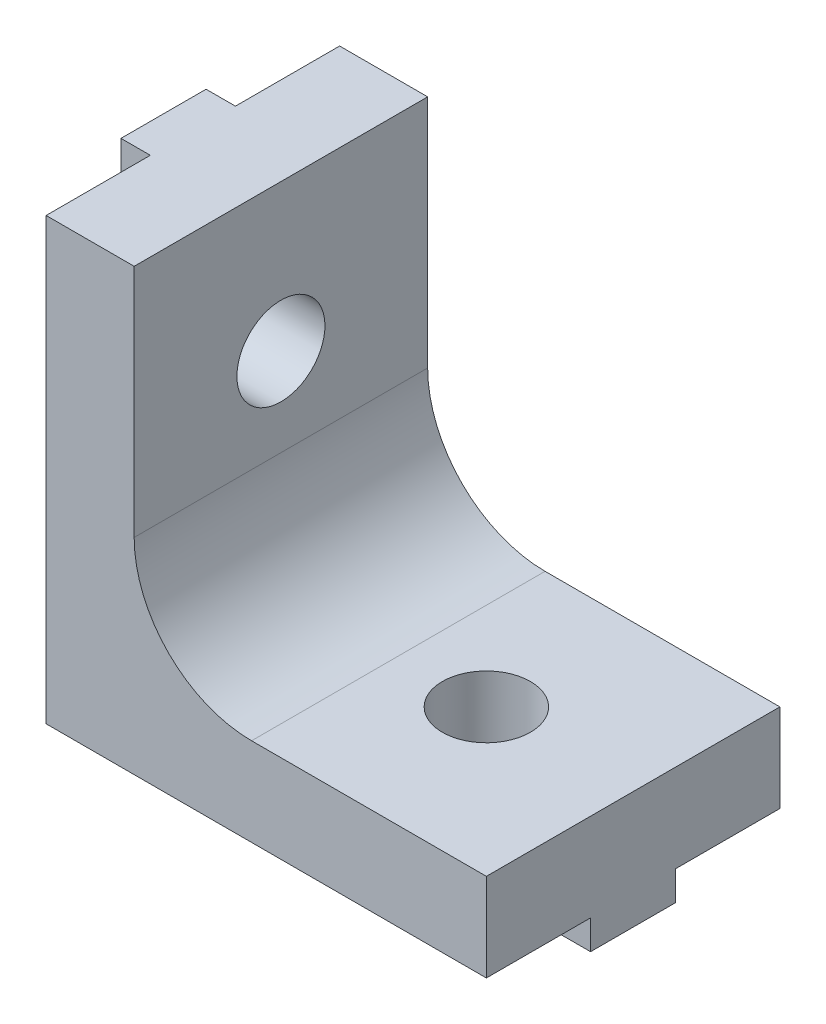
from build123d import *

# Parameters (mm, degrees)
BOSS_EXTRU_1_DEPTH           = 10
ESQUISSE4_W                  = 2.9
ESQUISSE4_H                  = 15
BOSS_EXTRU_2_DEPTH           = 1
ENL_V_MAT_EXTRU_1_DEPTH      = 24.452078799
ENL_V_MAT_EXTRU_1_DEPTH_BACK = 24.452078799
ESQUISSE2_R                  = 1.5
ESQUISSE5_W                  = 15
ESQUISSE5_H                  = 2.9
BOSS_EXTRU_3_DEPTH           = 1
ENL_V_MAT_EXTRU_2_DEPTH      = 24.452078799
ENL_V_MAT_EXTRU_2_DEPTH_BACK = 24.452078799
ESQUISSE3_R                  = 1.5


with BuildPart() as part:
    # Esquisse1 → Boss.-Extru.1 (new body)
    with BuildSketch(Plane.XY):
        with BuildLine():
            Line((0, 0), (15, 0))
            Line((15, 0), (15, 3))
            Line((15, 3), (7, 3))
            ThreePointArc((7, 3), (4.171572875, 4.171572875), (3, 7))
            Line((3, 7), (3, 15))
            Line((3, 15), (0, 15))
            Line((0, 15), (0, 0))
        make_face()
    extrude(amount=BOSS_EXTRU_1_DEPTH)

    # Esquisse4 → Boss.-Extru.2 (add)
    with BuildSketch(Plane.ZY):
        with Locations((5, 7.5)):
            Rectangle(ESQUISSE4_W, ESQUISSE4_H)
    extrude(amount=BOSS_EXTRU_2_DEPTH)

    # Esquisse2 → Enlèv. mat.-Extru.1 (cut, two sides: drawn at the far end of the back side and taken through both)
    with BuildSketch(Plane.ZY.offset(-ENL_V_MAT_EXTRU_1_DEPTH_BACK)):
        with Locations((5, 10)):
            Circle(ESQUISSE2_R)
    extrude(amount=ENL_V_MAT_EXTRU_1_DEPTH + ENL_V_MAT_EXTRU_1_DEPTH_BACK, mode=Mode.SUBTRACT)

    # Esquisse5 → Boss.-Extru.3 (add)
    with BuildSketch(Plane(origin=(0, 0, 0), x_dir=(-1, 0, 0), z_dir=(0, -1, 0))):
        with Locations((-7.5, -5)):
            Rectangle(ESQUISSE5_W, ESQUISSE5_H)
    extrude(amount=BOSS_EXTRU_3_DEPTH)

    # Esquisse3 → Enlèv. mat.-Extru.2 (cut, two sides: drawn at the far end of the back side and taken through both)
    with BuildSketch(Plane.XZ.offset(-ENL_V_MAT_EXTRU_2_DEPTH_BACK)):
        with Locations((10, 5)):
            Circle(ESQUISSE3_R)
    extrude(amount=ENL_V_MAT_EXTRU_2_DEPTH + ENL_V_MAT_EXTRU_2_DEPTH_BACK, mode=Mode.SUBTRACT)


solid = part.part
